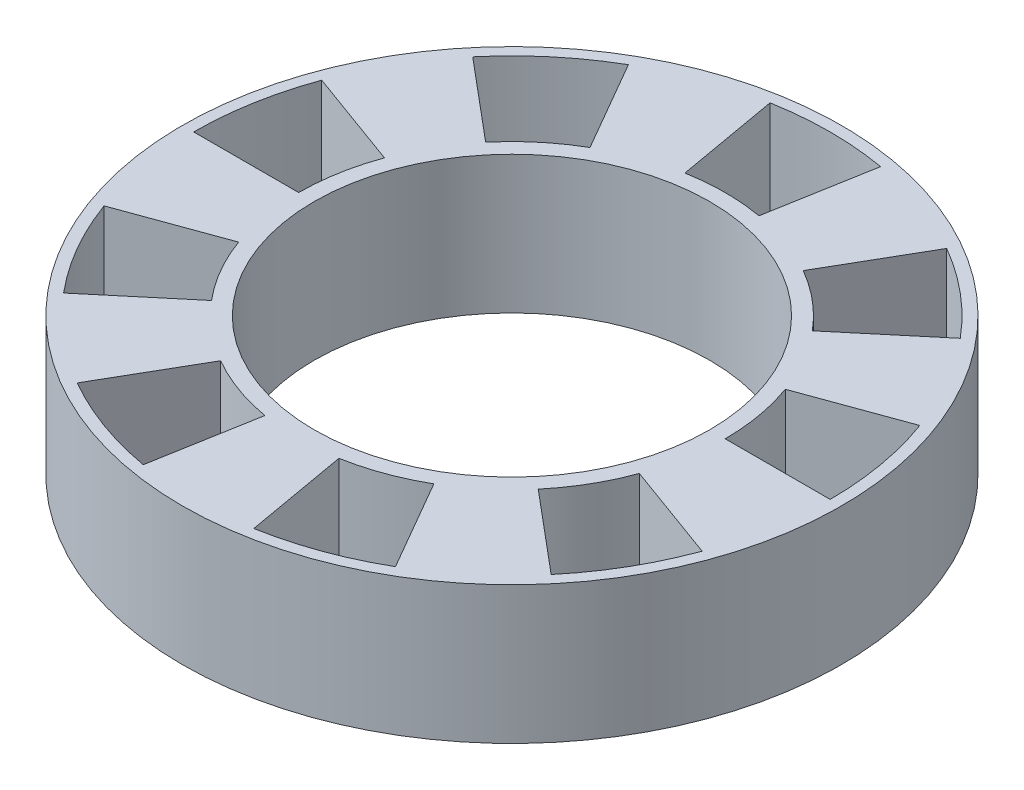
from build123d import *

# Parameters (mm, degrees)
SKETCH1_R           = 44.45
SKETCH1_R_2         = 26.67
BOSS_EXTRUDE1_DEPTH = 18.542
CUT_EXTRUDE1_REACH  = 67.539
CIRPATTERN1_COUNT   = 9


with BuildPart() as part:
    # Sketch1 → Boss-Extrude1 (new body)
    with BuildSketch(Plane(origin=(0, 0, 0), x_dir=(1, 0, 0), z_dir=(0, 1, 0))):
        Circle(SKETCH1_R)
        Circle(SKETCH1_R_2, mode=Mode.SUBTRACT)
    extrude(amount=BOSS_EXTRUDE1_DEPTH)

    # Sketch2 → Cut-Extrude1 (cut, up to next)
    with BuildSketch(Plane(origin=(0, 18.542, 0), x_dir=(1, 0, 0), z_dir=(0, 1, 0)), mode=Mode.PRIVATE) as cut_extrude1_sk1:
        with BuildLine():
            Line((-28.760847548, 0), (-42.922177943, 0))
            ThreePointArc((-42.922177943, 0), (-42.270093615, 7.453357981), (-40.333653882, 14.680249452))
            Line((-40.333653882, 14.680249452), (-27.026356208, 9.8367892))
            ThreePointArc((-27.026356208, 9.8367892), (-28.323905648, 4.994268765), (-28.760847548, 0))
        make_face()
    cut_extrude1_tool1 = extrude(cut_extrude1_sk1.sketch, amount=-CUT_EXTRUDE1_REACH, mode=Mode.PRIVATE) & part.part
    cut_extrude1 = cut_extrude1_tool1.solids().sort_by_distance((-35.574933, 18.542, -6.27282))[0]
    add(cut_extrude1, mode=Mode.SUBTRACT)

    # CirPattern1: Cut-Extrude1 ×9 about axis
    cirpattern1_axis = Axis((0, 18.542, 0), (0, -1, 0))
    for i in range(1, CIRPATTERN1_COUNT):
        add(cut_extrude1.rotate(cirpattern1_axis, i * 360 / CIRPATTERN1_COUNT), mode=Mode.SUBTRACT)


solid = part.part
